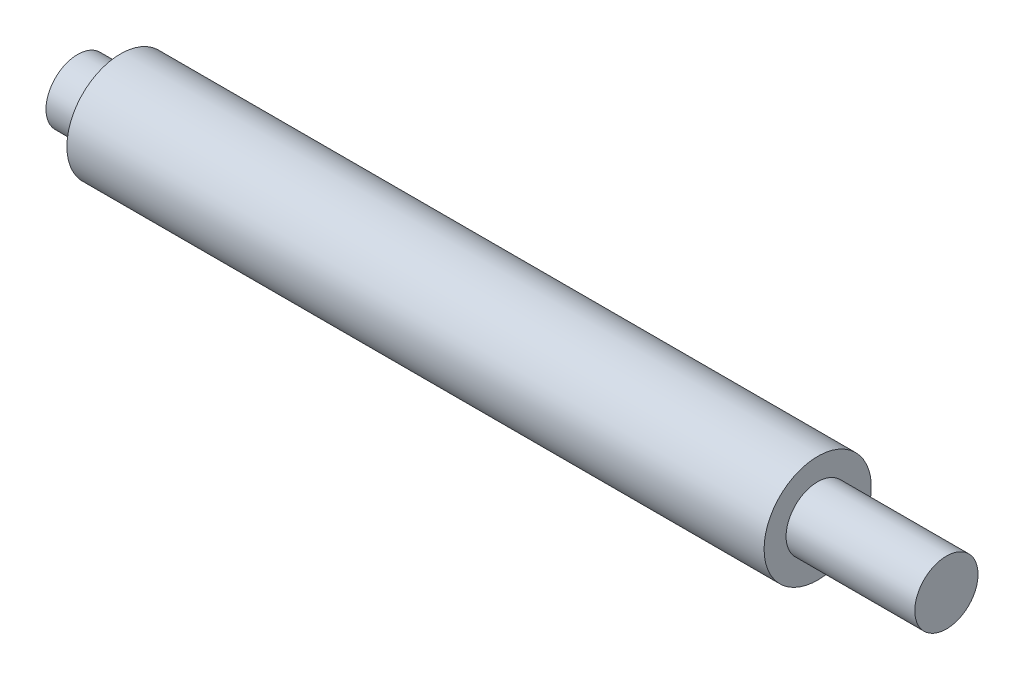
from build123d import *


with BuildPart() as part:
    # Sketch1 → Revolve1 (revolve)
    with BuildSketch(Plane.XY):
        Polygon((0, 0), (81, 0), (81, 2.95), (69, 2.95), (69, 5), (4, 5), (4, 2.95), (0, 2.95), align=None)
    revolve(axis=Axis((0, 0, 0), (1, 0, 0)))


solid = part.part
